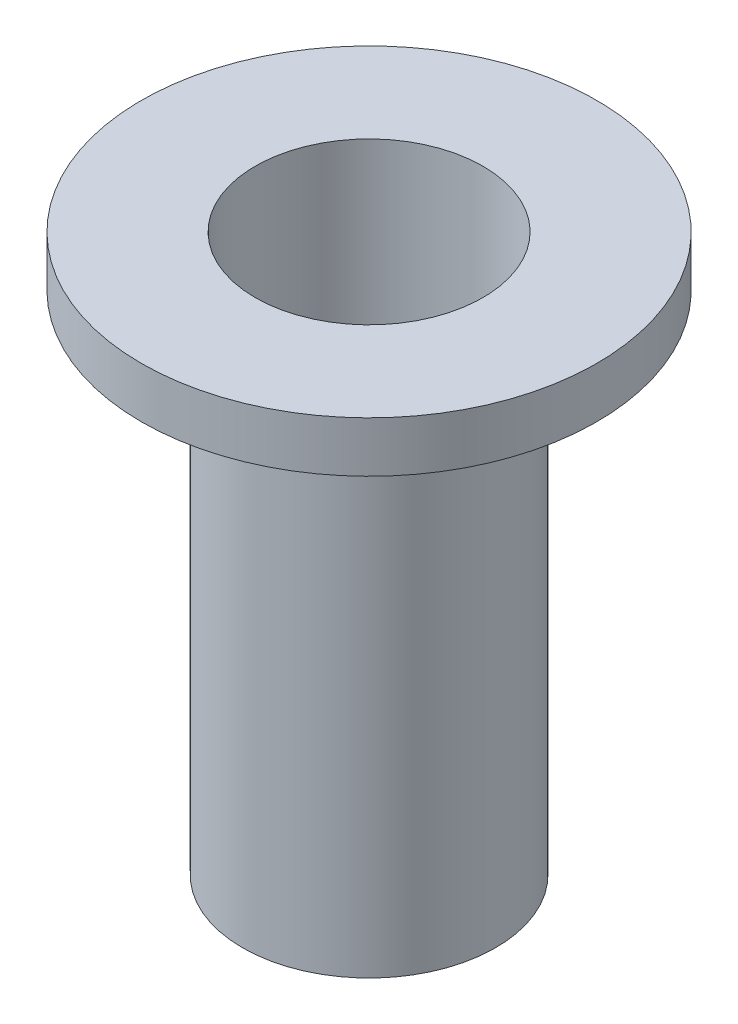
from build123d import *

# Parameters (mm, degrees)
SKETCH1_R           = 2.5
SKETCH1_R_2         = 2.25
BOSS_EXTRUDE1_DEPTH = 10
SKETCH2_R           = 4.5
SKETCH2_R_2         = 2.25
BOSS_EXTRUDE2_DEPTH = 1
SKETCH7_R           = 2.25
BOSS_EXTRUDE3_DEPTH = 5.5
SKETCH8_R           = 1.65
CUT_EXTRUDE1_DEPTH  = 13.708265027
THREAD2_PITCH       = 0.7


with BuildPart() as part:
    # Sketch1 → Boss-Extrude1 (new body)
    with BuildSketch(Plane(origin=(0, 0, 0), x_dir=(1, 0, 0), z_dir=(0, 1, 0))):
        with Locations(Location((0, 0, 0), (0, 0, 270))):
            Circle(SKETCH1_R)
        with Locations(Location((0, 0, 0), (0, 0, 270))):
            Circle(SKETCH1_R_2, mode=Mode.SUBTRACT)
    extrude(amount=BOSS_EXTRUDE1_DEPTH)

    # Sketch2 → Boss-Extrude2 (add)
    with BuildSketch(Plane(origin=(0, 10, 0), x_dir=(1, 0, 0), z_dir=(0, 1, 0))):
        with Locations(Location((0, 0, 0), (0, 0, 270))):
            Circle(SKETCH2_R)
        with Locations(Location((0, 0, 0), (0, 0, 270))):
            Circle(SKETCH2_R_2, mode=Mode.SUBTRACT)
    extrude(amount=BOSS_EXTRUDE2_DEPTH)

    # Sketch7 → Boss-Extrude3 (add)
    with BuildSketch(Plane.XZ):
        with Locations(Location((0, 0, 0), (0, 0, 90))):
            Circle(SKETCH7_R)
    extrude(amount=-BOSS_EXTRUDE3_DEPTH)

    # Sketch8 → Cut-Extrude1 (cut, through all)
    with BuildSketch(Plane.XZ):
        with Locations(Location((0, 0, 0), (0, 0, 270))):
            Circle(SKETCH8_R)
    extrude(amount=-CUT_EXTRUDE1_DEPTH, mode=Mode.SUBTRACT)

    # Thread2: the profile of Thread Profile2 profile screwed along a right-hand helix of 14.285714 turns, 6 arcs to a turn; built about Z, then put on its axis
    thread2_z = Axis((0, 0, 0), (0, 0, 1))
    thread2_corners = [(1.6497, 0, -0.000173205), (2.028886112, 0, 0.218749999), (2.028886112, 0, 0.306249999), (1.6497, 0, 0.525173203)]
    with BuildLine(mode=Mode.PRIVATE) as thread2_profile:
        Line(thread2_corners[0], thread2_corners[1])
        Line(thread2_corners[1], thread2_corners[2])
        Line(thread2_corners[2], thread2_corners[3])
        Line(thread2_corners[3], thread2_corners[0])
    thread2_cap = Face(thread2_profile.wire())
    thread2_turn_angles = [0, 30, 60, 90, 120, 150, 180, 210, 240, 270, 300, 330, 360]
    thread2_turn_weights = [1, 0.8660254037844387, 1, 0.8660254037844387, 1, 0.8660254037844387, 1, 0.8660254037844387, 1, 0.8660254037844387, 1, 0.8660254037844387, 1]
    thread2_turn_rails = [Edge.make_bspline([Vector(p[0], p[1], 0).rotate(thread2_z, thread2_turn_angles[k]) / thread2_turn_weights[k] + Vector(0, 0, p[2] + THREAD2_PITCH * thread2_turn_angles[k] / 360) for k in range(13)], [0, 0, 0, 1, 1, 2, 2, 3, 3, 4, 4, 5, 5, 6, 6, 6], 2, thread2_turn_weights) for p in thread2_corners]
    thread2_turn_sides = [Face.make_surface_from_curves(thread2_turn_rails[p[0]], thread2_turn_rails[p[1]]) for p in [(0, 1), (1, 2), (2, 3), (3, 0)]]
    thread2_last_angles = [5040, 5070, 5100, 5121.428571429, 5142.857142857]
    thread2_last_weights = [1, 0.8660254037844387, 1, 0.9308737486442035, 1]
    thread2_last_rails = [Edge.make_bspline([Vector(p[0], p[1], 0).rotate(thread2_z, thread2_last_angles[k]) / thread2_last_weights[k] + Vector(0, 0, p[2] + THREAD2_PITCH * thread2_last_angles[k] / 360) for k in range(5)], [0, 0, 0, 1, 1, 2, 2, 2], 2, thread2_last_weights) for p in thread2_corners]
    thread2_last_sides = [Face.make_surface_from_curves(thread2_last_rails[p[0]], thread2_last_rails[p[1]]) for p in [(0, 1), (1, 2), (2, 3), (3, 0)]]
    thread2 = Plane(origin=(0, -1, 0), x_dir=(1, 0, 0), z_dir=(0, 1, 0)) * Solid(Shell([*[p.moved(Location((0, 0, THREAD2_PITCH * i))) for i in range(14) for p in thread2_turn_sides], *thread2_last_sides, thread2_cap, thread2_cap.rotate(thread2_z, 5142.857142857).moved(Location((0, 0, THREAD2_PITCH * 5142.857142857 / 360)))]))
    add(thread2, mode=Mode.SUBTRACT)


solid = part.part
